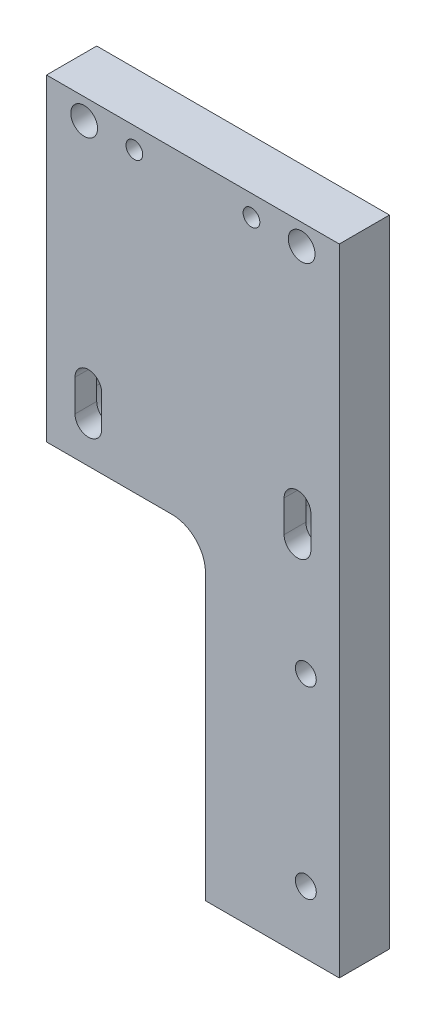
from build123d import *

# Parameters (mm, degrees)
SKETCH1_W                                      = 35
SKETCH1_H                                      = 6
BOSS_EXTRUDE1_DEPTH                            = 76
SKETCH2_R                                      = 1.6
CUT_EXTRUDE1_DEPTH                             = 84.886828525
SKETCH3_R                                      = 1
CUT_EXTRUDE2_DEPTH                             = 4
CBORE_START                                    = -6
CBORE_SLOT_FOR_M3_HEX_SOCKET_HEAD_CAP_SC_DEPTH = 3.4
CBORE_START_2                                  = -2.6
CBORE_SLOT_FOR_M3_HEX_SOCKET_HEAD_CA_3_DEPTH   = 2.6
CUT_EXTRUDE3_DEPTH                             = 84.886828525
SKETCH8_R                                      = 1.25
CUT_EXTRUDE4_DEPTH                             = 84.886828525


# Read off the part's stored shape, not the designer's step: CBORE SLOT for M3 Hex Socket Head Cap Screw1
with BuildPart() as part:
    # Sketch1 → Boss-Extrude1 (new body)
    with BuildSketch(Plane(origin=(0, 0, 0), x_dir=(1, 0, 0), z_dir=(0, 1, 0))):
        with Locations((17.5, 3)):
            Rectangle(SKETCH1_W, SKETCH1_H)
    extrude(amount=BOSS_EXTRUDE1_DEPTH)

    # Sketch2 → Cut-Extrude1 (cut, through all)
    with BuildSketch(Plane.XY):
        with Locations((4.5, 73.5)):
            Circle(SKETCH2_R)
        with Locations((30.5, 73.5)):
            Circle(SKETCH2_R)
    extrude(amount=-CUT_EXTRUDE1_DEPTH, mode=Mode.SUBTRACT)

    # Sketch3 → Cut-Extrude2 (cut)
    with BuildSketch(Plane.XY):
        with Locations((10.5, 73.5)):
            Circle(SKETCH3_R)
        with Locations((24.5, 73.5)):
            Circle(SKETCH3_R)
    extrude(amount=-CUT_EXTRUDE2_DEPTH, mode=Mode.SUBTRACT)

    # CBORE SLOT for M3 Hex Socket Head Ca 2 → CBORE SLOT for M3 Hex Socket Head Cap Screw1 (cut)
    with BuildSketch(Plane.XY.offset(CBORE_START)):
        with BuildLine():
            ThreePointArc((8.25, 46.4), (5, 49.65), (1.75, 46.4))
            Line((1.75, 46.4), (1.75, 42.6))
            ThreePointArc((1.75, 42.6), (5, 39.35), (8.25, 42.6))
            Line((8.25, 42.6), (8.25, 46.4))
        make_face()
        with BuildLine():
            ThreePointArc((33.25, 46.4), (30, 49.65), (26.75, 46.4))
            Line((26.75, 46.4), (26.75, 42.6))
            ThreePointArc((26.75, 42.6), (30, 39.35), (33.25, 42.6))
            Line((33.25, 42.6), (33.25, 46.4))
        make_face()
    extrude(amount=CBORE_SLOT_FOR_M3_HEX_SOCKET_HEAD_CAP_SC_DEPTH, mode=Mode.SUBTRACT)

    # CBORE SLOT for M3 Hex Socket Head Ca 3 o → CBORE SLOT for M3 Hex Socket Head Ca 3 (cut)
    with BuildSketch(Plane.XY.offset(CBORE_START_2)):
        with BuildLine():
            ThreePointArc((6.6, 46.4), (5, 48), (3.4, 46.4))
            Line((3.4, 46.4), (3.4, 42.6))
            ThreePointArc((3.4, 42.6), (5, 41), (6.6, 42.6))
            Line((6.6, 42.6), (6.6, 46.4))
        make_face()
        with BuildLine():
            ThreePointArc((31.6, 46.4), (30, 48), (28.4, 46.4))
            Line((28.4, 46.4), (28.4, 42.6))
            ThreePointArc((28.4, 42.6), (30, 41), (31.6, 42.6))
            Line((31.6, 42.6), (31.6, 46.4))
        make_face()
    extrude(amount=CBORE_SLOT_FOR_M3_HEX_SOCKET_HEAD_CA_3_DEPTH, mode=Mode.SUBTRACT)

    # Sketch7 → Cut-Extrude3 (cut, through all)
    with BuildSketch(Plane(origin=(0, 0, -6), x_dir=(-1, 0, 0), z_dir=(0, 0, -1))):
        with BuildLine():
            Line((0, 0), (-19, 0))
            Line((-19, 0), (-19, 34))
            ThreePointArc((-19, 34), (-17.828427125, 36.828427125), (-15, 38))
            Line((-15, 38), (0, 38))
            Line((0, 38), (0, 0))
        make_face()
    extrude(amount=-CUT_EXTRUDE3_DEPTH, mode=Mode.SUBTRACT)

    # Sketch8 → Cut-Extrude4 (cut, through all)
    with BuildSketch(Plane(origin=(0, 0, -6), x_dir=(-1, 0, 0), z_dir=(0, 0, -1))):
        with Locations((-31, 7.5)):
            Circle(SKETCH8_R)
        with Locations(Location((-31, 29.5, 0), (0, 0, 180))):
            Circle(SKETCH8_R)
    extrude(amount=-CUT_EXTRUDE4_DEPTH, mode=Mode.SUBTRACT)


solid = part.part
